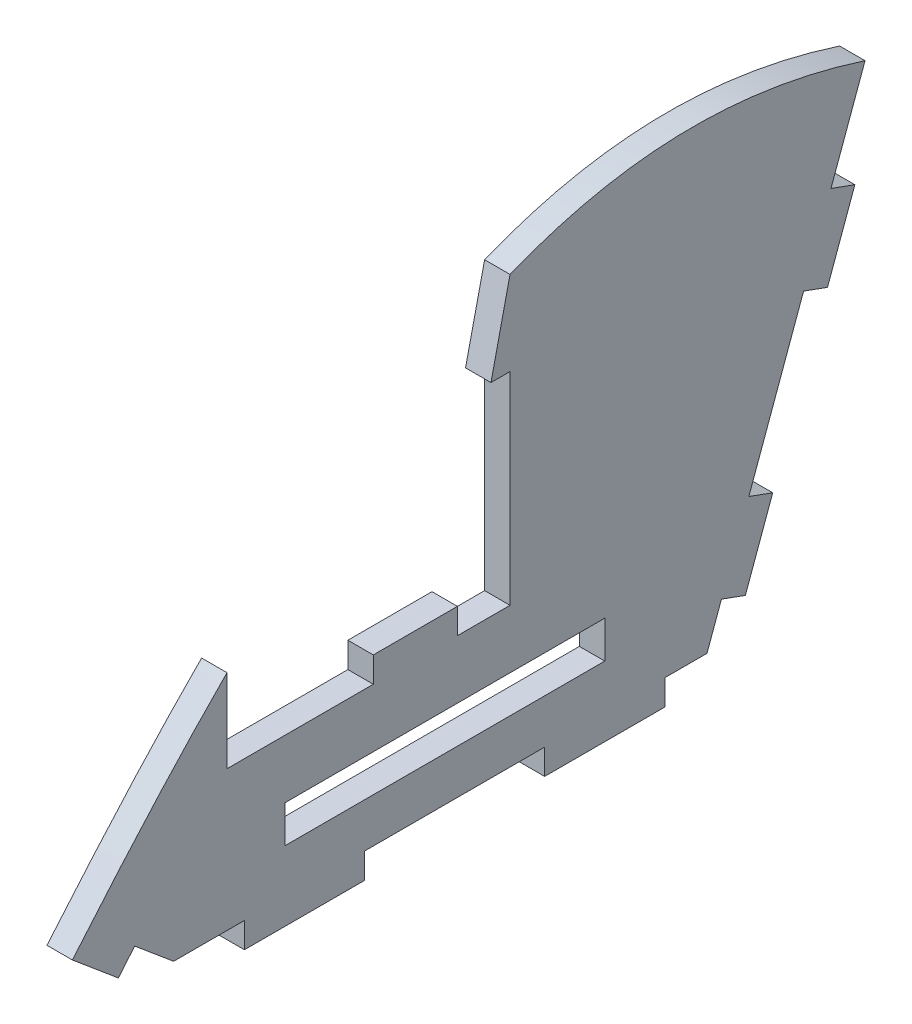
from build123d import *

# Parameters (mm, degrees)
VERTICALSUPPORT_START     = -8.727944435
VERTICALSUPPORT_OUTLINE_W = 4.644211625
VERTICALSUPPORT_OUTLINE_H = 39.932212354
VERTICALSUPPORT_DEPTH     = 3.175
SKETCH1_W                 = 7.5
SKETCH1_H                 = 17.511250173
CUT_EXTRUDE1_DEPTH        = 70.171999778


# Read off the part's stored shape, not the designer's step: VerticalSupport
with BuildPart() as part:
    # VerticalSupport outline → VerticalSupport (new body)
    with BuildSketch(Plane.YZ.offset(VERTICALSUPPORT_START)):
        with BuildLine():
            Line((3.674649338, -56.776141905), (13.071575546, -60.196343338))
            Line((13.071575546, -60.196343338), (14.157489501, -57.212819267))
            Line((14.157489501, -57.212819267), (25.850623416, -61.468771968))
            add(Edge.make_bspline(
                [(24.902673716, -17.12538653), (30.294038787, -30.457344803), (31.214851934, -44.900745737), (25.850623416, -61.468771968)],
                knots=[0.580400882, 0.580400882, 0.580400882, 0.580400882, 0.976268241, 0.976268241, 0.976268241, 0.976268241], degree=3))
            Line((24.902673716, -17.12538653), (14.394673716, -14.74413653))
            Line((14.394673716, -14.74413653), (14.394673716, -17.12538653))
            Line((14.394673716, -17.12538653), (-10.888823942, -17.12538653))
            Line((-10.888823942, -17.12538653), (-10.888823942, -10.55438653))
            Line((-10.888823942, -10.55438653), (-7.713823942, -10.55438653))
            Line((-7.713823942, -10.55438653), (-7.713823942, -0.04638653))
            Line((-7.713823942, -0.04638653), (-10.888823942, -0.04638653))
            Line((-10.888823942, -0.04638653), (-10.888823942, 10.72461347))
            Line((-10.888823942, 10.72461347), (6.622426231, 10.72461347))
            add(Edge.make_bspline(
                [(-21.922009797, 37.540280116), (-11.188458316, 28.533761028), (-1.433315203, 19.729402601), (6.622426231, 10.72461347)],
                knots=[0, 0, 0, 0, 0.291032797, 0.291032797, 0.291032797, 0.291032797], degree=3))
            Line((-21.922009797, 37.540280116), (-26.742916869, 31.794946793))
            Line((-26.742916869, 31.794946793), (-24.310725762, 29.754096132))
            Line((-24.310725762, 29.754096132), (-28.388823942, 24.894007976))
            Line((-28.388823942, 24.894007976), (-28.388823942, 16.04961347))
            Line((-28.388823942, 16.04961347), (-31.563823942, 16.04961347))
            Line((-31.563823942, 16.04961347), (-31.563823942, 1.04961347))
            Line((-31.563823942, 1.04961347), (-28.388823942, 1.04961347))
            Line((-28.388823942, 1.04961347), (-28.388823942, -21.45038653))
            Line((-28.388823942, -21.45038653), (-31.563823942, -21.45038653))
            Line((-31.563823942, -21.45038653), (-31.563823942, -36.45038653))
            Line((-31.563823942, -36.45038653), (-28.388823942, -36.45038653))
            Line((-28.388823942, -36.45038653), (-28.388823942, -41.727227597))
            Line((-28.388823942, -41.727227597), (-23.430215331, -43.532013534))
            Line((-23.430215331, -43.532013534), (-24.516129286, -46.515537605))
            Line((-24.516129286, -46.515537605), (-15.119203078, -49.935739039))
            Line((-15.119203078, -49.935739039), (-14.033289123, -46.952214968))
            Line((-14.033289123, -46.952214968), (4.760563293, -53.792617834))
            Line((4.760563293, -53.792617834), (3.674649338, -56.776141905))
        make_face()
        with Locations((-20.51645306, -8.993872337)):
            Rectangle(VERTICALSUPPORT_OUTLINE_W, VERTICALSUPPORT_OUTLINE_H, mode=Mode.SUBTRACT)
    extrude(amount=VERTICALSUPPORT_DEPTH)

    # Sketch1 → Cut-Extrude1 (cut, through all)
    with BuildSketch(Plane(origin=(-5.552944435, 0, 0), x_dir=(0, 0, -1), z_dir=(1, 0, 0))):
        with Locations((-14.47461347, -2.133198855)):
            Rectangle(SKETCH1_W, SKETCH1_H)
    extrude(amount=-CUT_EXTRUDE1_DEPTH, mode=Mode.SUBTRACT)


solid = part.part
